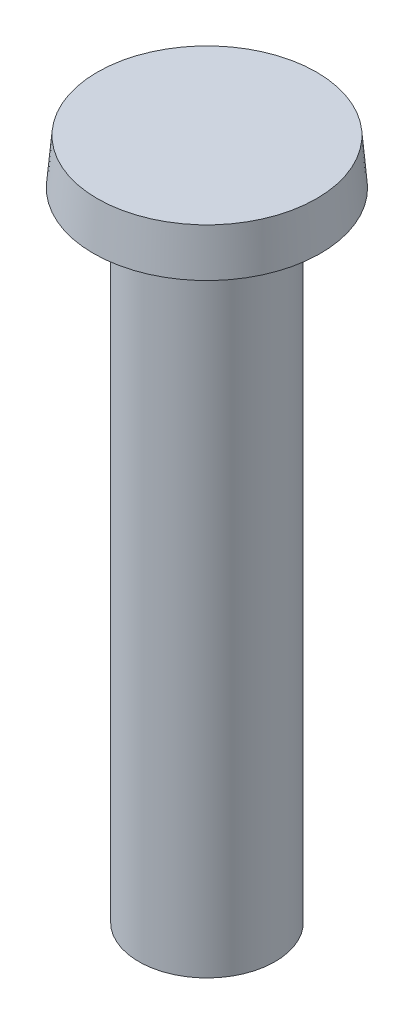
from build123d import *

# Parameters (mm, degrees)
SKETCH1_R           = 2.25
BOSS_EXTRUDE1_DEPTH = 21
SKETCH2_R           = 3.75
BOSS_EXTRUDE2_DEPTH = 1.5
BOSS_EXTRUDE2_TAPER = 5
SKETCH3_R           = 0.75
CUT_EXTRUDE1_DEPTH  = 4
CUT_EXTRUDE1_DRAFT  = -5


with BuildPart() as part:
    # Sketch1 → Boss-Extrude1 (new body)
    with BuildSketch(Plane(origin=(0, 0, 0), x_dir=(1, 0, 0), z_dir=(0, 1, 0))):
        Circle(SKETCH1_R)
    extrude(amount=BOSS_EXTRUDE1_DEPTH)

    # Sketch2 → Boss-Extrude2 (add)
    with BuildSketch(Plane(origin=(0, 21, 0), x_dir=(1, 0, 0), z_dir=(0, 1, 0))):
        Circle(SKETCH2_R)
    extrude(amount=BOSS_EXTRUDE2_DEPTH, taper=BOSS_EXTRUDE2_TAPER)


with BuildPart() as cut_extrude1_tool:
    # Sketch3 → Cut-Extrude1 (with draft: the straight prism first)
    with BuildSketch(Plane.XZ):
        Circle(SKETCH3_R)
    extrude(amount=-CUT_EXTRUDE1_DEPTH)
    # Cut-Extrude1: the draft: its side faces are tilted about the plane it starts from
    cut_extrude1_sides = [cut_extrude1_tool.faces().sort_by_distance(p)[0] for p in [
        (-0.75, 2, 0),
    ]]
    draft(cut_extrude1_sides, Plane.XZ, CUT_EXTRUDE1_DRAFT)


with BuildPart() as part_1:
    add(part.part)

    # Cut-Extrude1: cut by cut_extrude1_tool
    add(cut_extrude1_tool.part, mode=Mode.SUBTRACT)


solid = part_1.part
